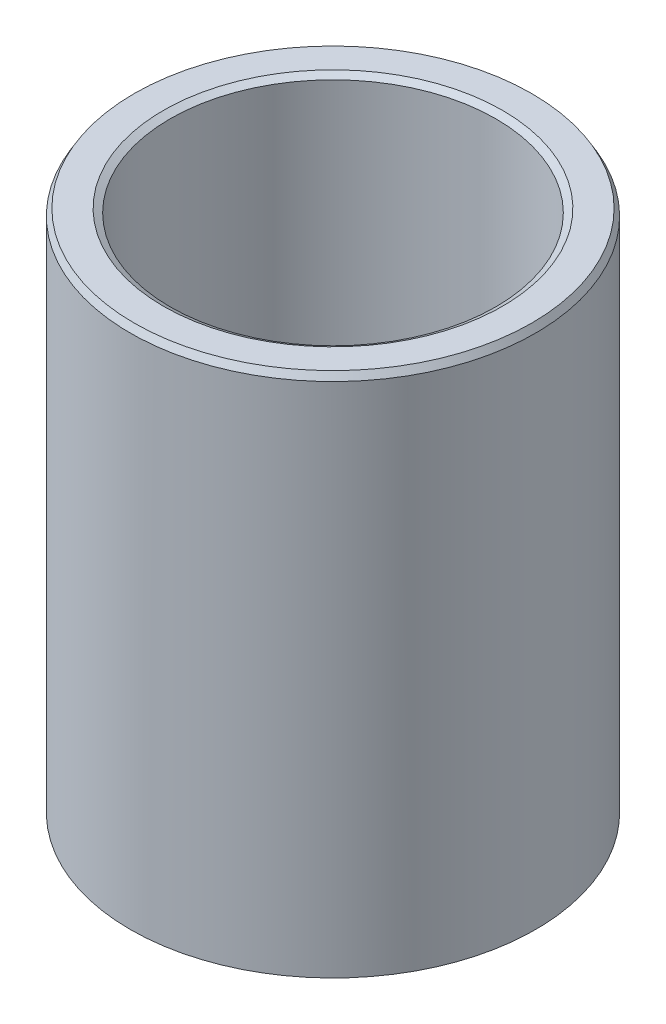
from build123d import *
from OCP.BRepFilletAPI import BRepFilletAPI_MakeChamfer

# Parameters (mm, degrees)
SKETCH1_R           = 60
BOSS_EXTRUDE1_DEPTH = 156.056264528
SKETCH2_R           = 48.221371414
CUT_EXTRUDE1_DEPTH  = 178.633211136
CHAMFER1_SIZE       = 1.995947002
CHAMFER1_SIZE2      = 1.152360539


with BuildPart() as part:
    # Sketch1 → Boss-Extrude1 (new body)
    with BuildSketch(Plane(origin=(0, 0, 0), x_dir=(1, 0, 0), z_dir=(0, 1, 0))):
        Circle(SKETCH1_R)
    extrude(amount=BOSS_EXTRUDE1_DEPTH)

    # Sketch2 → Cut-Extrude1 (cut, through all)
    with BuildSketch(Plane(origin=(0, 0, 0), x_dir=(1, 0, 0), z_dir=(0, 1, 0))):
        Circle(SKETCH2_R)
    extrude(amount=CUT_EXTRUDE1_DEPTH, mode=Mode.SUBTRACT)

    # Chamfer1: one chamfer whose edges measure the first distance from different faces: ONE call of the kernel's chamfer builder (chamfer() names one face for all edges)
    chamfer1_edges_1 = [part.edges().sort_by_distance(p)[0] for p in [
        (-48.221371414, 156.056264528, 0),
    ]]
    chamfer1_side_1 = [part.faces().sort_by_distance(p)[0] for p in [
        (-58.302943725, 156.056264528, 0),
    ]]
    chamfer1_edges_2 = [part.edges().sort_by_distance(p)[0] for p in [
        (-48.221371414, 0, 0),
    ]]
    chamfer1_side_2 = [part.faces().sort_by_distance(p)[0] for p in [
        (-48.221371414, 78.028132264, 0),
    ]]
    chamfer1_edges_3 = [part.edges().sort_by_distance(p)[0] for p in [
        (-60, 0, 0),
    ]]
    chamfer1_side_3 = [part.faces().sort_by_distance(p)[0] for p in [
        (-58.302943725, 0, 0),
    ]]
    chamfer1_edges_4 = [part.edges().sort_by_distance(p)[0] for p in [
        (-60, 156.056264528, 0),
    ]]
    chamfer1_side_4 = [part.faces().sort_by_distance(p)[0] for p in [
        (-60, 78.028132264, 0),
    ]]
    chamfer1 = BRepFilletAPI_MakeChamfer(part.part.solid().wrapped)
    for e in chamfer1_edges_1:
        chamfer1.Add(CHAMFER1_SIZE, CHAMFER1_SIZE2, e.wrapped, chamfer1_side_1[0].wrapped)  # the first distance lies on this face
    for e in chamfer1_edges_2:
        chamfer1.Add(CHAMFER1_SIZE, CHAMFER1_SIZE2, e.wrapped, chamfer1_side_2[0].wrapped)  # the first distance lies on this face
    for e in chamfer1_edges_3:
        chamfer1.Add(CHAMFER1_SIZE, CHAMFER1_SIZE2, e.wrapped, chamfer1_side_3[0].wrapped)  # the first distance lies on this face
    for e in chamfer1_edges_4:
        chamfer1.Add(CHAMFER1_SIZE, CHAMFER1_SIZE2, e.wrapped, chamfer1_side_4[0].wrapped)  # the first distance lies on this face
    add(Compound.cast(chamfer1.Shape()), mode=Mode.REPLACE)


solid = part.part
